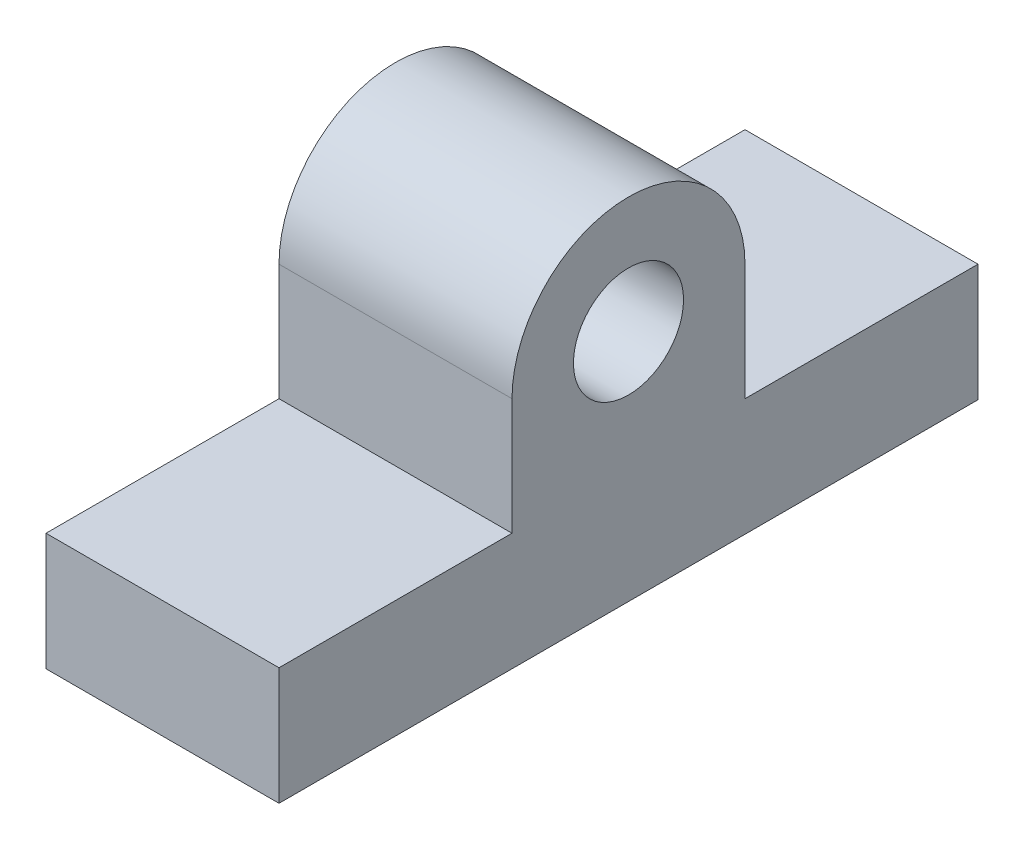
from build123d import *

# Parameters (mm, degrees)
BOSS_EXTRUDE1_DEPTH = 25.4
SKETCH2_R           = 6
CUT_EXTRUDE1_DEPTH  = 53.412021522


with BuildPart() as part:
    # Sketch1 → Boss-Extrude1 (new body)
    with BuildSketch(Plane(origin=(0, 0, 0), x_dir=(0, 0, -1), z_dir=(1, 0, 0))):
        with BuildLine():
            Line((12.7, 0), (12.7, -12.7))
            Line((12.7, -12.7), (38.1, -12.7))
            Line((38.1, -12.7), (38.1, -25.5))
            Line((38.1, -25.5), (-38.1, -25.5))
            Line((-38.1, -25.5), (-38.1, -12.7))
            Line((-38.1, -12.7), (-12.7, -12.7))
            Line((-12.7, -12.7), (-12.7, 0))
            ThreePointArc((-12.7, 0), (0, 12.7), (12.7, 0))
        make_face()
    extrude(amount=BOSS_EXTRUDE1_DEPTH)

    # Sketch2 → Cut-Extrude1 (cut, through all)
    with BuildSketch(Plane(origin=(25.4, 0, 0), x_dir=(0, 0, -1), z_dir=(1, 0, 0))):
        Circle(SKETCH2_R)
    extrude(amount=-CUT_EXTRUDE1_DEPTH, mode=Mode.SUBTRACT)


solid = part.part
